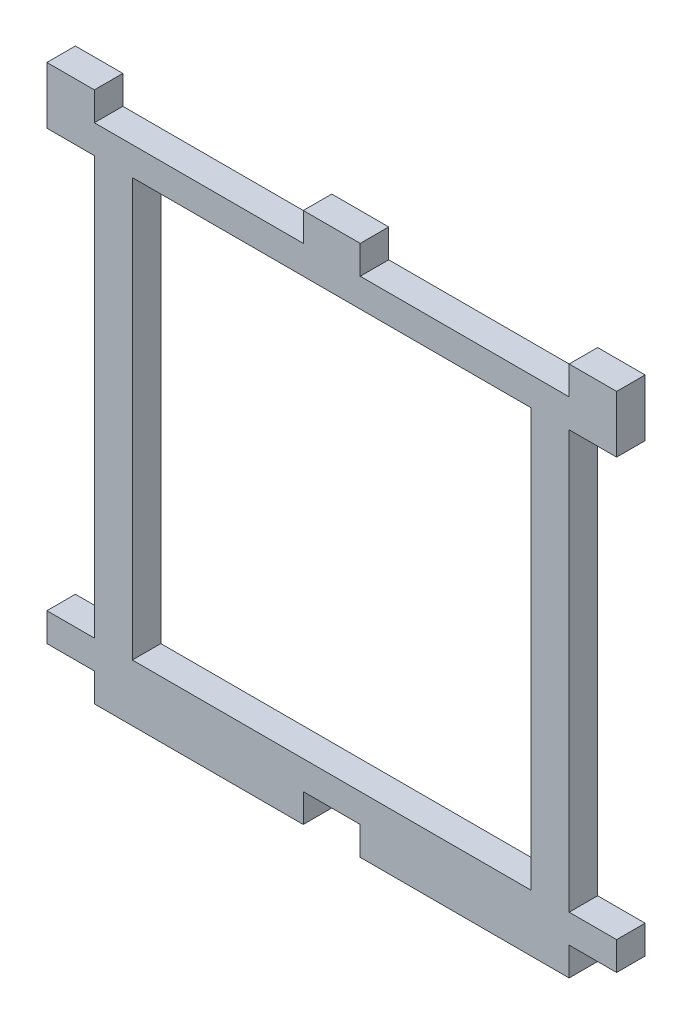
from build123d import *

# Parameters (mm, degrees)
SKETCH1_W           = 42
SKETCH1_H           = 44
BOSS_EXTRUDE1_DEPTH = 3


with BuildPart() as part:
    # Sketch1 → Boss-Extrude1 (new body)
    with BuildSketch(Plane.XY):
        Polygon((-41.282447519, 35.995778619), (-36.282447519, 35.995778619), (-36.282447519, -8.004221381), (-41.282447519, -8.004221381), (-41.282447519, -11.004221381), (-36.282447519, -11.004221381), (-36.282447519, -14.004221381), (-14.282447519, -14.004221381), (-14.282447519, -11.004221381), (-8.282447519, -11.004221381), (-8.282447519, -14.004221381), (13.717552481, -14.004221381), (13.717552481, -11.004221381), (18.717552481, -11.004221381), (18.717552481, -8.004221381), (13.717552481, -8.004221381), (13.717552481, 35.995778619), (18.717552481, 35.995778619), (18.717552481, 41.995778619), (13.717552481, 41.995778619), (13.717552481, 38.995778619), (-8.282447519, 38.995778619), (-8.282447519, 41.995778619), (-14.282447519, 41.995778619), (-14.282447519, 38.995778619), (-36.282447519, 38.995778619), (-36.282447519, 41.995778619), (-41.282447519, 41.995778619), align=None)
        with Locations((-11.282447519, 13.995778619)):
            Rectangle(SKETCH1_W, SKETCH1_H, mode=Mode.SUBTRACT)
    extrude(amount=BOSS_EXTRUDE1_DEPTH)


solid = part.part
